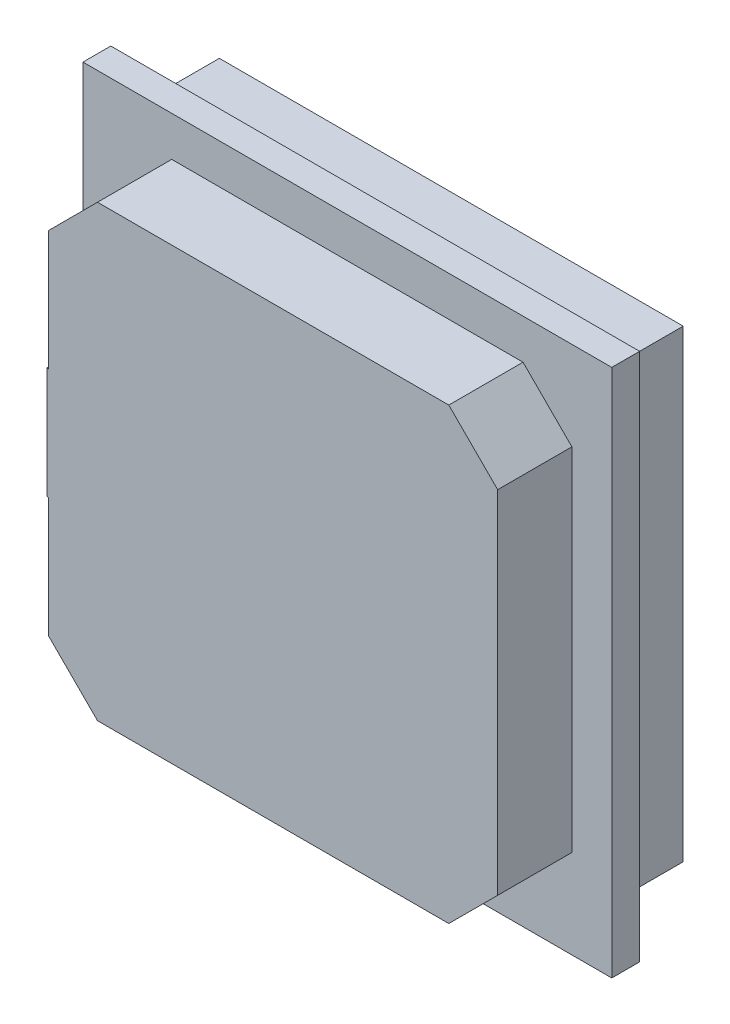
from build123d import *

# Parameters (mm, degrees)
CROQUIS1_W              = 28.5
CROQUIS1_H              = 28.5
SALIENTE_EXTRUIR1_DEPTH = 1.5
SALIENTE_EXTRUIR2_DEPTH = 4
CROQUIS3_W              = 25
CROQUIS3_H              = 25
SALIENTE_EXTRUIR3_DEPTH = 4.1
CROQUIS4_W              = 4
CROQUIS4_H              = 6
SALIENTE_EXTRUIR4_DEPTH = 0.1
VACIADO2_START          = -3.1
VACIADO2_DEPTH          = 7.6
VACIADO2_2_DEPTH        = 3.6
VACIADO2_START_2        = 1
VACIADO2_3_OUTLINE_W    = 0.7
VACIADO2_3_OUTLINE_H    = 4
VACIADO2_3_DEPTH        = 3.5


# Read off the part's stored shape, not the designer's step: Vaciado2
with BuildPart() as part:
    # Croquis1 → Saliente-Extruir1 (new body)
    with BuildSketch(Plane.XY):
        Rectangle(CROQUIS1_W, CROQUIS1_H)
    extrude(amount=SALIENTE_EXTRUIR1_DEPTH)

    # Croquis2 → Saliente-Extruir2 (add)
    with BuildSketch(Plane.XY.offset(1.5)):
        Polygon((-12.1, 9.466756826), (-9.466756826, 12.1), (9.466756826, 12.1), (12.1, 9.466756826), (12.1, -9.466756826), (9.466756826, -12.1), (-9.466756826, -12.1), (-12.1, -9.466756826), align=None)
    extrude(amount=SALIENTE_EXTRUIR2_DEPTH)

    # Croquis3 → Saliente-Extruir3 (add)
    with BuildSketch(Plane(origin=(0, 0, 0), x_dir=(-1, 0, 0), z_dir=(0, 0, -1))):
        Rectangle(CROQUIS3_W, CROQUIS3_H)
    extrude(amount=SALIENTE_EXTRUIR3_DEPTH)

    # Croquis4 → Saliente-Extruir4 (add)
    with BuildSketch(Plane.ZY.offset(12.1)):
        with Locations((3.5, 0)):
            Rectangle(CROQUIS4_W, CROQUIS4_H)
    extrude(amount=SALIENTE_EXTRUIR4_DEPTH)

    # Vaciado2 outline → Vaciado2 (cut)
    with BuildSketch(Plane.XY.offset(VACIADO2_START)):
        Polygon((-11.1, 2), (-11.5, 2), (-11.5, -2), (-11.1, -2), (-11.1, -9.052543264), (-9.052543264, -11.1), (9.052543264, -11.1), (11.1, -9.052543264), (11.1, 9.052543264), (9.052543264, 11.1), (-9.052543264, 11.1), (-11.1, 9.052543264), align=None)
    extrude(amount=VACIADO2_DEPTH, mode=Mode.SUBTRACT)

    # Vaciado2 2 outline → Vaciado2 2 (cut)
    with BuildSketch(Plane.XY.offset(VACIADO2_START)):
        Polygon((-11.5, 11.5), (-11.5, 2), (-11.1, 2), (-11.1, 9.052543264), (-9.052543264, 11.1), (9.052543264, 11.1), (11.1, 9.052543264), (11.1, -9.052543264), (9.052543264, -11.1), (-9.052543264, -11.1), (-11.1, -9.052543264), (-11.1, -2), (-11.5, -2), (-11.5, -11.5), (11.5, -11.5), (11.5, 11.5), align=None)
    extrude(amount=VACIADO2_2_DEPTH, mode=Mode.SUBTRACT)

    # Vaciado2 3 outline → Vaciado2 3 (cut)
    with BuildSketch(Plane.XY.offset(VACIADO2_START_2)):
        with Locations((-11.85, 0)):
            Rectangle(VACIADO2_3_OUTLINE_W, VACIADO2_3_OUTLINE_H)
    extrude(amount=VACIADO2_3_DEPTH, mode=Mode.SUBTRACT)


solid = part.part
